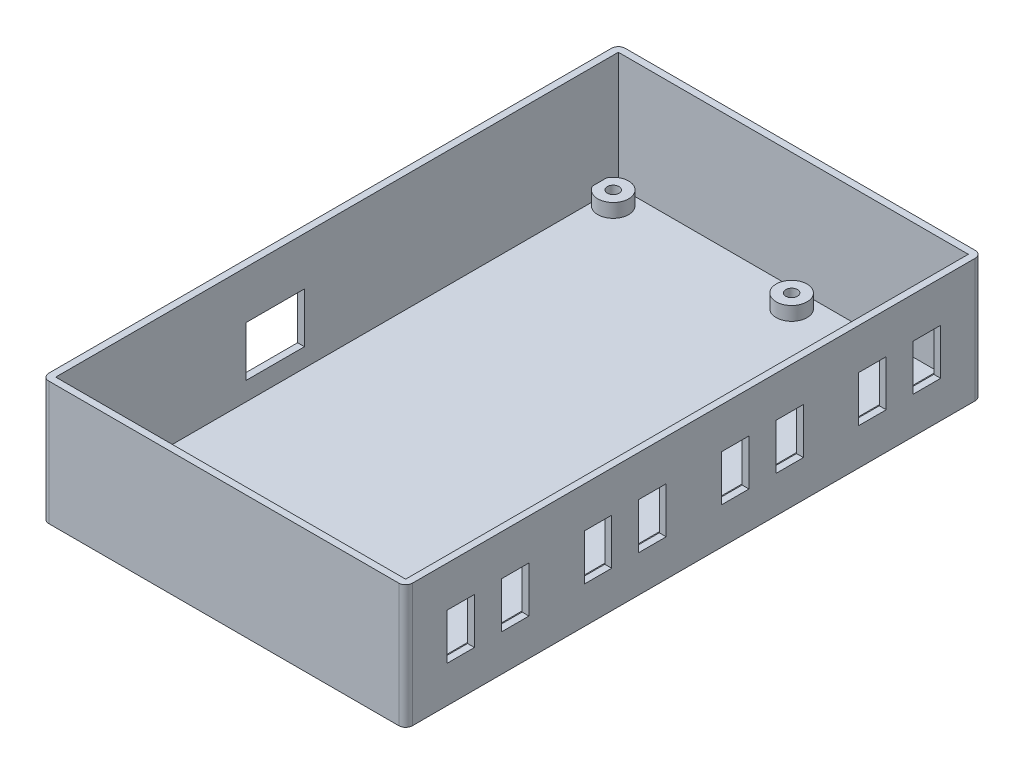
from build123d import *

# Parameters (mm, degrees)
SKIZZE1_W                                    = 106
SKIZZE1_H                                    = 168
AUFSATZ_LINEAR_AUSTRAGEN1_DEPTH              = 36
WANDUNG1_T                                   = -2
SKIZZE2_R                                    = 4.5
AUFSATZ_LINEAR_AUSTRAGEN2_DEPTH              = 4
VERRUNDUNG1_R                                = 2
STIRNSENKUNG_F_R_M3_ZYLINDERSCHRAUBE_2_COUNT = 2
STIRNSENKUNG_F_R_M3_ZYLINDERSCHRAUBE_2_PITCH = 161.595173195
STIRNSENKUNG_F_R_M3_ZYLINDERSCHRAUBE_3_COUNT = 2
STIRNSENKUNG_F_R_M3_ZYLINDERSCHRAUBE_3_PITCH = 153
STIRNSENKUNG_F_R_M3_ZYLINDERSCHRAUBE_4_COUNT = 2
STIRNSENKUNG_F_R_M3_ZYLINDERSCHRAUBE_4_PITCH = 52
SKIZZE7_W                                    = 17
SKIZZE7_H                                    = 14.6
SCHNITT_LINEAR_AUSTRAGEN1_DEPTH              = 10
SKIZZE8_W                                    = 8
SKIZZE8_H                                    = 13.4
SCHNITT_LINEAR_AUSTRAGEN2_DEPTH              = 10
SKIZZE9_W                                    = 5
SKIZZE9_H                                    = 164
AUFSATZ_LINEAR_AUSTRAGEN3_DEPTH              = 4
LINEARES_MUSTER1_COUNT                       = 4
LINEARES_MUSTER1_PITCH                       = 40


with BuildPart() as part:
    # Skizze1 → Aufsatz-Linear austragen1 (new body)
    with BuildSketch(Plane(origin=(0, 0, 0), x_dir=(1, 0, 0), z_dir=(0, 1, 0))):
        with Locations((53, 84)):
            Rectangle(SKIZZE1_W, SKIZZE1_H)
    extrude(amount=AUFSATZ_LINEAR_AUSTRAGEN1_DEPTH)

    # Wandung1
    wandung1_openings = [part.faces().sort_by_distance(p)[0] for p in [
        (53, 36, -84),
    ]]
    offset(amount=WANDUNG1_T, openings=wandung1_openings, kind=Kind.INTERSECTION)

    # Skizze2 → Aufsatz-Linear austragen2 (add)
    with BuildSketch(Plane(origin=(0, 2, 0), x_dir=(1, 0, 0), z_dir=(0, 1, 0))):
        with Locations((6, 7.5)):
            Circle(SKIZZE2_R)
        with Locations((58, 7.5)):
            Circle(SKIZZE2_R)
        with Locations((58, 160.5)):
            Circle(SKIZZE2_R)
        with Locations((6, 160.5)):
            Circle(SKIZZE2_R)
    extrude(amount=AUFSATZ_LINEAR_AUSTRAGEN2_DEPTH)

    # Verrundung1
    verrundung1_edges = [part.edges().sort_by_distance(p)[0] for p in [
        (0, 18, -168),
        (106, 18, -168),
        (106, 18, 0),
        (0, 18, 0),
    ]]
    fillet(verrundung1_edges, radius=VERRUNDUNG1_R)

    # Skizze6 → Stirnsenkung für M3 Zylinderschraube mit Innensechskant1 (revolve, cut)
    with BuildSketch(Plane(origin=(58, 0, -7.5), x_dir=(0, 0, -1), z_dir=(1, 0, 0))):
        Polygon((0, 0), (0, 15.021463052), (1.7, 14), (1.7, 3.4), (3.25, 3.4), (3.25, 0.025), (3.275, 0), align=None)
    stirnsenkung_f_r_m3_zylinderschraube_mit = revolve(axis=Axis((58, -6.35, -7.5), (0, 1, 0)), mode=Mode.SUBTRACT)

    # Stirnsenkung f_r M3 Zylinderschraube 2: Stirnsenkung für M3 Zylinderschraube mit Innensechskant1 ×2
    with Locations(*[Vector(-0.32179178976573125, 0, -0.9468104583491711) * (i * STIRNSENKUNG_F_R_M3_ZYLINDERSCHRAUBE_2_PITCH) for i in range(1, STIRNSENKUNG_F_R_M3_ZYLINDERSCHRAUBE_2_COUNT)]):
        add(stirnsenkung_f_r_m3_zylinderschraube_mit, mode=Mode.SUBTRACT)

    # Stirnsenkung f_r M3 Zylinderschraube 3: Stirnsenkung für M3 Zylinderschraube mit Innensechskant1 ×2
    with Locations(*[(0, 0, -i * STIRNSENKUNG_F_R_M3_ZYLINDERSCHRAUBE_3_PITCH) for i in range(1, STIRNSENKUNG_F_R_M3_ZYLINDERSCHRAUBE_3_COUNT)]):
        add(stirnsenkung_f_r_m3_zylinderschraube_mit, mode=Mode.SUBTRACT)

    # Stirnsenkung f_r M3 Zylinderschraube 4: Stirnsenkung für M3 Zylinderschraube mit Innensechskant1 ×2
    with Locations(*[(-i * STIRNSENKUNG_F_R_M3_ZYLINDERSCHRAUBE_4_PITCH, 0, 0) for i in range(1, STIRNSENKUNG_F_R_M3_ZYLINDERSCHRAUBE_4_COUNT)]):
        add(stirnsenkung_f_r_m3_zylinderschraube_mit, mode=Mode.SUBTRACT)

    # Skizze7 → Schnitt-Linear austragen1 (cut)
    with BuildSketch(Plane.ZY):
        with Locations((-66, 14.72)):
            Rectangle(SKIZZE7_W, SKIZZE7_H)
    extrude(amount=-SCHNITT_LINEAR_AUSTRAGEN1_DEPTH, mode=Mode.SUBTRACT)

    # Skizze8 → Schnitt-Linear austragen2 (cut)
    with BuildSketch(Plane(origin=(106, 0, 0), x_dir=(0, 0, -1), z_dir=(1, 0, 0))):
        with Locations((16.06, 17.42)):
            Rectangle(SKIZZE8_W, SKIZZE8_H)
        with Locations((31.94, 17.42)):
            Rectangle(SKIZZE8_W, SKIZZE8_H)
    schnitt_linear_austragen2 = extrude(amount=-SCHNITT_LINEAR_AUSTRAGEN2_DEPTH, mode=Mode.SUBTRACT)

    # Skizze9 → Aufsatz-Linear austragen3 (add)
    with BuildSketch(Plane(origin=(0, 2, 0), x_dir=(1, 0, 0), z_dir=(0, 1, 0))):
        with Locations((101.5, 84)):
            Rectangle(SKIZZE9_W, SKIZZE9_H)
    extrude(amount=AUFSATZ_LINEAR_AUSTRAGEN3_DEPTH)

    # Lineares Muster1: Schnitt-Linear austragen2 ×4
    with Locations(*[(0, 0, -i * LINEARES_MUSTER1_PITCH) for i in range(1, LINEARES_MUSTER1_COUNT)]):
        add(schnitt_linear_austragen2, mode=Mode.SUBTRACT)


solid = part.part
